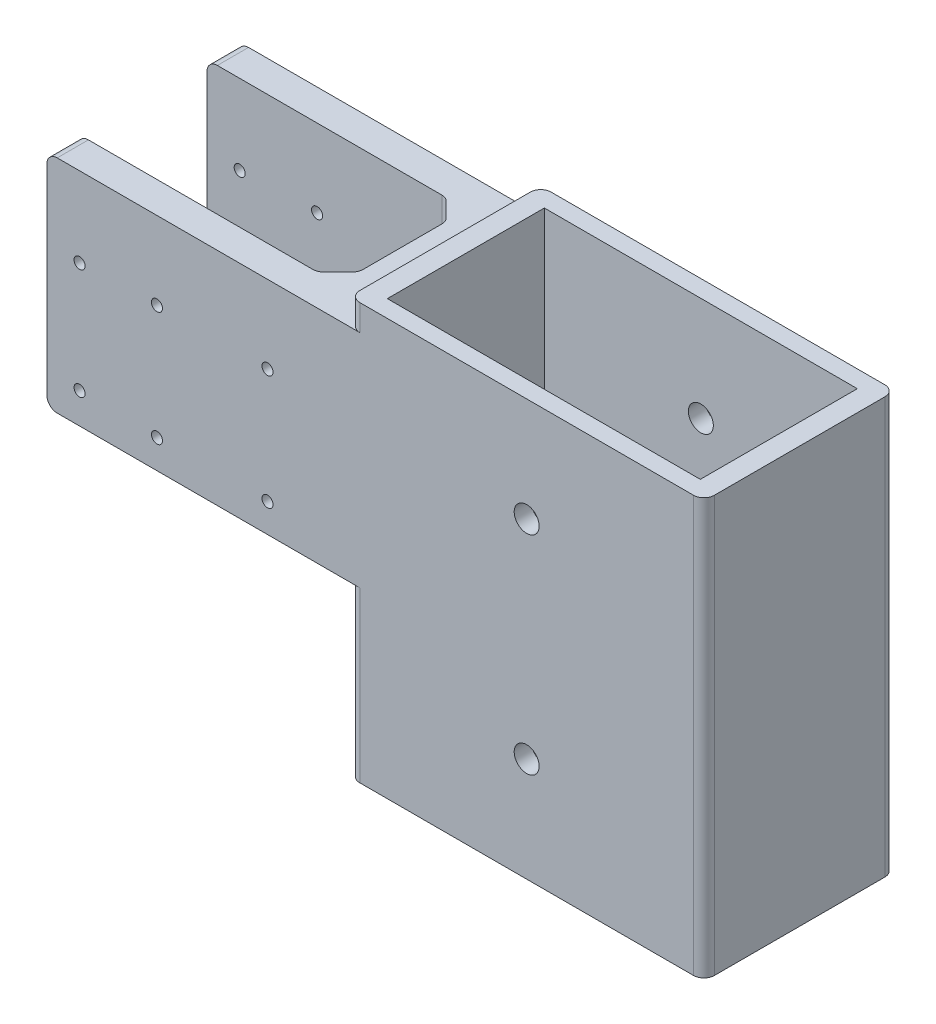
from build123d import *

# Parameters (mm, degrees)
SKETCH1_R           = 1.35
BOSS_EXTRUDE1_DEPTH = 46.736
SKETCH2_W           = 76.454
SKETCH2_H           = 38.354
CUT_EXTRUDE1_DEPTH  = 137.16
FILLET1_R           = 2.54
SKETCH3_R           = 3.05
CUT_EXTRUDE2_DEPTH  = 66.294


with BuildPart() as part:
    # Sketch1 → Boss-Extrude1 (new body)
    with BuildSketch(Plane.XY):
        Polygon((-53.90661, 47), (-53.90661, -7), (20, -7), (20, -48.25), (106.614, -48.25), (106.614, 53.35), (20, 53.35), (20, 47), align=None)
        Circle(SKETCH1_R, mode=Mode.SUBTRACT)
        with Locations((-27, 0)):
            Circle(SKETCH1_R, mode=Mode.SUBTRACT)
        with Locations((-45.90661, 0.5)):
            Circle(SKETCH1_R, mode=Mode.SUBTRACT)
        with Locations((-45.90661, 27.5)):
            Circle(SKETCH1_R, mode=Mode.SUBTRACT)
        with Locations((-27, 28)):
            Circle(SKETCH1_R, mode=Mode.SUBTRACT)
        with Locations((0, 28)):
            Circle(SKETCH1_R, mode=Mode.SUBTRACT)
    extrude(amount=BOSS_EXTRUDE1_DEPTH)

    # Sketch2 → Cut-Extrude1 (cut)
    with BuildSketch(Plane(origin=(0, 53.35, 0), x_dir=(1, 0, 0), z_dir=(0, 1, 0))):
        Polygon((-53.90661, -7.62), (4.51339, -7.62), (9.59339, -12.7), (9.59339, -34.036), (4.51339, -39.116), (-53.90661, -39.116), align=None)
        with Locations((63.307, -23.368)):
            Rectangle(SKETCH2_W, SKETCH2_H)
    extrude(amount=-CUT_EXTRUDE1_DEPTH, mode=Mode.SUBTRACT)

    # Fillet1
    fillet1_edges = [part.edges().sort_by_distance(p)[0] for p in [
        (106.614, 2.55, 0),
        (106.614, 2.55, 46.736),
        (4.51339, 20, 39.116),
        (9.59339, 20, 34.036),
        (9.59339, 20, 12.7),
        (4.51339, 20, 7.62),
        (20, 50.175, 0),
        (20, 50.175, 46.736),
        (20, -27.625, 0),
        (20, -27.625, 46.736),
        (-53.90661, -7, 42.926),
        (-53.90661, -7, 3.81),
        (-53.90661, 47, 3.81),
        (-53.90661, 47, 42.926),
    ]]
    fillet(fillet1_edges, radius=FILLET1_R)

    # Sketch3 → Cut-Extrude2 (cut)
    with BuildSketch(Plane.XY.offset(46.736)):
        with Locations((63.307, 27.95)):
            Circle(SKETCH3_R)
        with Locations((63.307, -22.85)):
            Circle(SKETCH3_R)
    extrude(amount=-CUT_EXTRUDE2_DEPTH, mode=Mode.SUBTRACT)


solid = part.part
